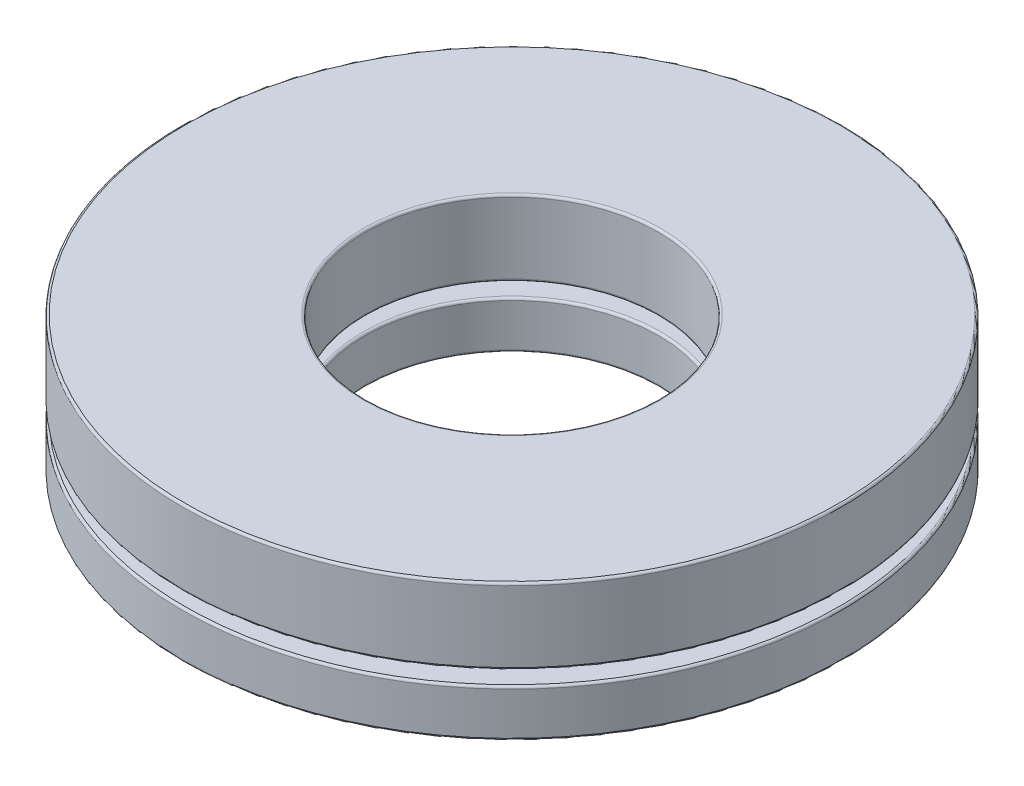
from build123d import *

# Parameters (mm, degrees)
SKETCH1_W         = 3.96875
SKETCH1_H         = 1.021291666
CIRPATTERN1_COUNT = 7
CIRPATTERN1_ANGLE = 308.571428571
CIRPATTERN2_COUNT = 7
SKETCH4_W         = 3.96875
SKETCH4_H         = 1.634066667
FILLET1_R         = 0.049022
FILLET2_R         = 0.049022


with BuildPart() as part:
    # Sketch1 → Revolve1 (revolve)
    with BuildSketch(Plane(origin=(0, 0, 0), x_dir=(0, 0, -1), z_dir=(1, 0, 0))):
        with Locations((-5.159375, 0)):
            Rectangle(SKETCH1_W, SKETCH1_H)
    revolve(axis=Axis((0, -2.4511, 0), (0, 1, 0)))

    # Sketch3 → Cut-Revolve1 (revolve, cut)
    with BuildSketch(Plane(origin=(0, 0, 0), x_dir=(0, 0, -1), z_dir=(1, 0, 0))):
        with BuildLine():
            Line((-5.159375, 0.817033333), (-5.159375, -0.817033333))
            ThreePointArc((-5.159375, -0.817033333), (-5.976408333, 0), (-5.159375, 0.817033333))
        make_face()
    cut_revolve1 = revolve(axis=Axis((0, 0.817033333, 5.159375), (0, -1, 0)), mode=Mode.SUBTRACT)

    # CirPattern2: Cut-Revolve1 ×7 about axis
    cirpattern2_axis = Axis((0, 2.4511, 0), (0, -1, 0))
    for i in range(1, CIRPATTERN2_COUNT):
        add(cut_revolve1.rotate(cirpattern2_axis, i * 360 / CIRPATTERN2_COUNT), mode=Mode.SUBTRACT)

    # Fillet2
    fillet2_edges = [part.edges().sort_by_distance(p)[0] for p in [
        (0, -0.510645833, -3.175),
        (0, 0.510645833, -3.175),
        (0, -0.510645833, -7.14375),
        (0, 0.510645833, -7.14375),
    ]]
    fillet(fillet2_edges, radius=FILLET2_R)


with BuildPart() as body_2:
    # Sketch2 → Revolve2 (revolve)
    with BuildSketch(Plane(origin=(0, 0, 0), x_dir=(0, 0, -1), z_dir=(1, 0, 0))):
        with BuildLine():
            Line((-5.159375, 0.817033333), (-5.159375, -0.817033333))
            ThreePointArc((-5.159375, -0.817033333), (-5.976408333, 0), (-5.159375, 0.817033333))
        make_face()
    revolve(axis=Axis((0, 0.817033333, 5.159375), (0, -1, 0)))


with BuildPart() as cirpattern1_1:
    # CirPattern1: pattern copy
    add(body_2.part.rotate(Axis((0, 2.4511, 0), (0, -1, 0)), 1 * CIRPATTERN1_ANGLE / (CIRPATTERN1_COUNT - 1)))


with BuildPart() as cirpattern1_2:
    # CirPattern1: pattern copy
    add(body_2.part.rotate(Axis((0, 2.4511, 0), (0, -1, 0)), 2 * CIRPATTERN1_ANGLE / (CIRPATTERN1_COUNT - 1)))


with BuildPart() as cirpattern1_3:
    # CirPattern1: pattern copy
    add(body_2.part.rotate(Axis((0, 2.4511, 0), (0, -1, 0)), 3 * CIRPATTERN1_ANGLE / (CIRPATTERN1_COUNT - 1)))


with BuildPart() as cirpattern1_4:
    # CirPattern1: pattern copy
    add(body_2.part.rotate(Axis((0, 2.4511, 0), (0, -1, 0)), 4 * CIRPATTERN1_ANGLE / (CIRPATTERN1_COUNT - 1)))


with BuildPart() as cirpattern1_5:
    # CirPattern1: pattern copy
    add(body_2.part.rotate(Axis((0, 2.4511, 0), (0, -1, 0)), 5 * CIRPATTERN1_ANGLE / (CIRPATTERN1_COUNT - 1)))


with BuildPart() as cirpattern1_6:
    # CirPattern1: pattern copy
    add(body_2.part.rotate(Axis((0, 2.4511, 0), (0, -1, 0)), 6 * CIRPATTERN1_ANGLE / (CIRPATTERN1_COUNT - 1)))


with BuildPart() as body_9:
    # Sketch4 → Revolve3 (revolve)
    with BuildSketch(Plane(origin=(0, 0, 0), x_dir=(0, 0, -1), z_dir=(1, 0, 0))):
        with Locations((-5.159375, 1.634066667)):
            Rectangle(SKETCH4_W, SKETCH4_H)
    revolve(axis=Axis((0, -2.4511, 0), (0, 1, 0)))

    # Fillet1
    fillet1_edges = [body_9.edges().sort_by_distance(p)[0] for p in [
        (0, 0.817033333, -3.175),
        (0, 2.4511, -3.175),
        (0, 0.817033333, -7.14375),
        (0, 2.4511, -7.14375),
    ]]
    fillet(fillet1_edges, radius=FILLET1_R)


solid = Compound([part.part, body_2.part, cirpattern1_1.part, cirpattern1_2.part, cirpattern1_3.part, cirpattern1_4.part, cirpattern1_5.part, cirpattern1_6.part, body_9.part])
